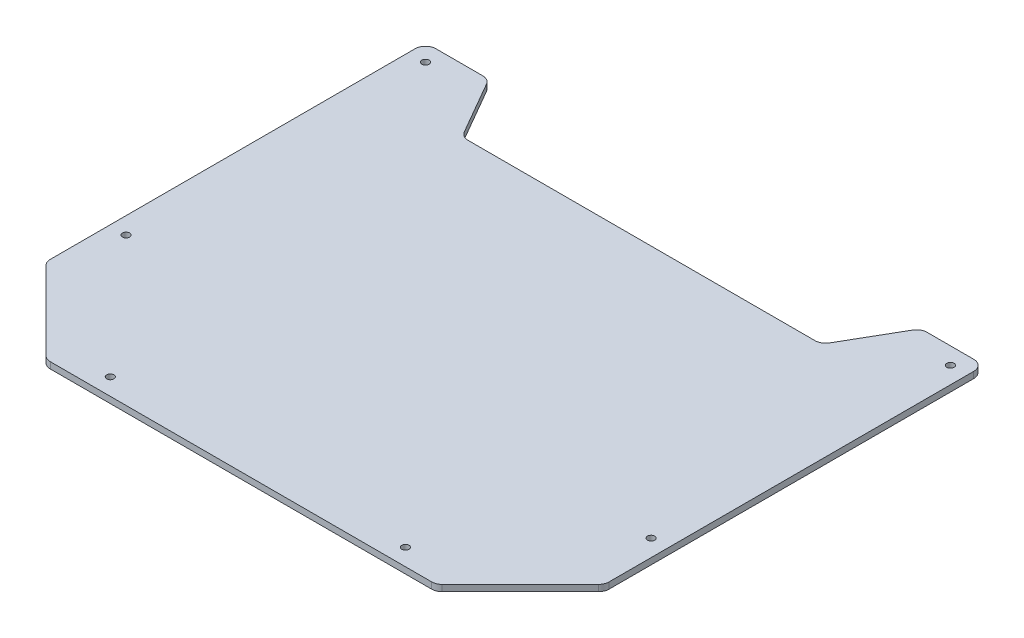
from build123d import *

# Parameters (mm, degrees)
BOSS_EXTRU_1_DEPTH      = 3
CONG_1_R                = 5
ESQUISSE2_R             = 1
ENL_V_MAT_EXTRU_1_DEPTH = 257.837010573
D_GAGEMENT_M31_D        = 3.4


with BuildPart() as part:
    # Esquisse1 → Boss.-Extru.1 (new body)
    with BuildSketch(Plane(origin=(0, 0, 0), x_dir=(1, 0, 0), z_dir=(0, 1, 0))):
        Polygon((-92.5, 0), (92.5, 0), (132.5, 40), (132.5, 220), (102.5, 220), (85.179491924, 190), (-85.179491924, 190), (-102.5, 220), (-132.5, 220), (-132.5, 40), align=None)
    extrude(amount=BOSS_EXTRU_1_DEPTH)

    # Congé1
    cong_1_edges = [part.edges().sort_by_distance(p)[0] for p in [
        (132.5, 1.5, -220),
        (102.5, 1.5, -220),
        (85.179491924, 1.5, -190),
        (-85.179491924, 1.5, -190),
        (-102.5, 1.5, -220),
        (-132.5, 1.5, -220),
        (-132.5, 1.5, -40),
        (-92.5, 1.5, 0),
        (92.5, 1.5, 0),
        (132.5, 1.5, -40),
    ]]
    fillet(cong_1_edges, radius=CONG_1_R)

    # Esquisse2 → Enlèv. mat.-Extru.1 (cut, through all)
    with BuildSketch(Plane.XZ):
        with Locations((-70, -8)):
            Circle(ESQUISSE2_R)
        with Locations((-124.5, -70)):
            Circle(ESQUISSE2_R)
        with Locations((-124.5, -212)):
            Circle(ESQUISSE2_R)
        with Locations((124.5, -212)):
            Circle(ESQUISSE2_R)
        with Locations((124.5, -70)):
            Circle(ESQUISSE2_R)
        with Locations((70, -8)):
            Circle(ESQUISSE2_R)
    extrude(amount=-ENL_V_MAT_EXTRU_1_DEPTH, mode=Mode.SUBTRACT)

    # Dégagement M31 (through all)
    with Locations(Plane(origin=(0, 0, 0), x_dir=(-1, 0, 0), z_dir=(0, -1, 0))):
        with Locations((-70, 8), (-124.5, 70), (-124.5, 212), (124.5, 212), (124.5, 70), (70, 8)):
            Hole(D_GAGEMENT_M31_D / 2)


solid = part.part
